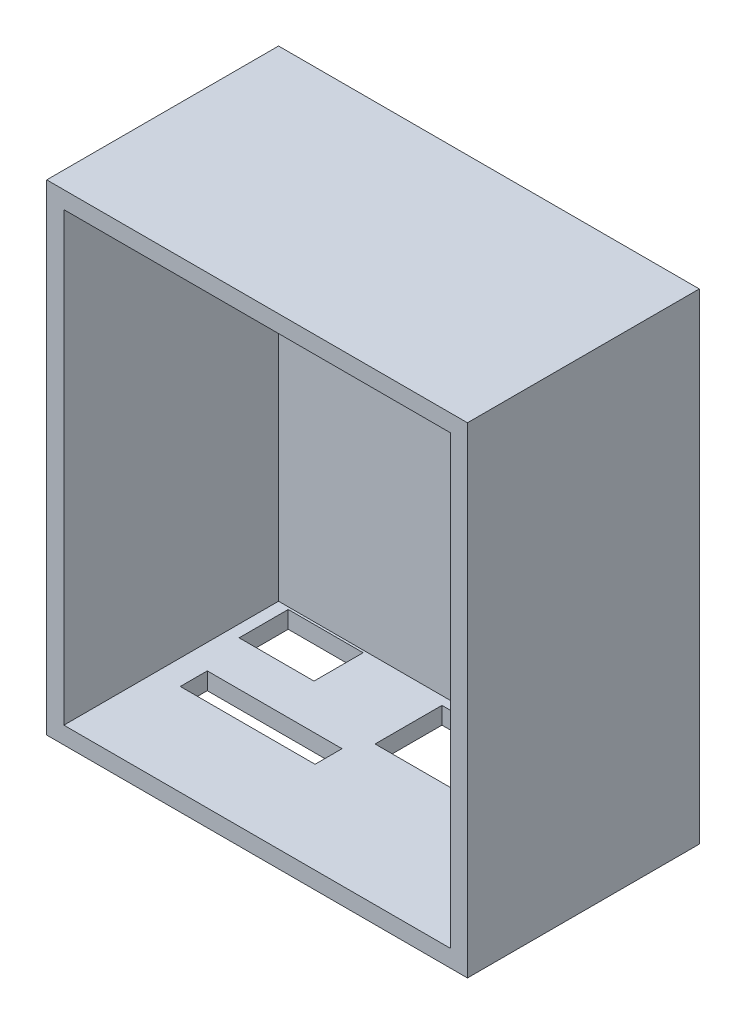
from build123d import *

# Parameters (mm, degrees)
SCHIZZO1_W                   = 49
SCHIZZO1_H                   = 56
ESTRUSIONE_ESTRUSIONE1_DEPTH = 2
SCHIZZO3_W                   = 49
SCHIZZO3_H                   = 2
ESTRUSIONE_ESTRUSIONE2_DEPTH = 25
SCHIZZO4_W                   = 2
SCHIZZO4_H                   = 54
ESTRUSIONE_ESTRUSIONE3_DEPTH = 25
SCHIZZO5_W                   = 47
SCHIZZO5_H                   = 2
ESTRUSIONE_ESTRUSIONE4_DEPTH = 25
SCHIZZO6_W                   = 2
SCHIZZO6_H                   = 52
ESTRUSIONE_ESTRUSIONE5_DEPTH = 25
SCHIZZO7_W                   = 25
SCHIZZO7_H                   = 3
ESTRUSIONE_ESTRUSIONE6_DEPTH = 13.3
SCHIZZO9_W                   = 3.5
SCHIZZO9_H                   = 52
ESTRUSIONE_ESTRUSIONE7_DEPTH = 13.3
SCHIZZO10_W                  = 4
SCHIZZO10_H                  = 1.5
TAGLIO_ESTRUSIONE1_DEPTH     = 6
SCHIZZO11_W                  = 1.5
SCHIZZO11_H                  = 1.5
TAGLIO_ESTRUSIONE2_DEPTH     = 6
SCHIZZO12_W                  = 4
SCHIZZO12_H                  = 1
TAGLIO_ESTRUSIONE3_DEPTH     = 0.75
SCHIZZO13_W                  = 4
SCHIZZO13_H                  = 1
TAGLIO_ESTRUSIONE4_DEPTH     = 0.75
SCHIZZO14_W                  = 4
SCHIZZO14_H                  = 1
TAGLIO_ESTRUSIONE5_DEPTH     = 0.75
SCHIZZO15_W                  = 4
SCHIZZO15_H                  = 1
TAGLIO_ESTRUSIONE6_DEPTH     = 0.75
SCHIZZO21_W                  = 1
SCHIZZO21_H                  = 1.5
TAGLIO_ESTRUSIONE7_DEPTH     = 1
SCHIZZO23_W                  = 2.5
SCHIZZO23_H                  = 0.75
TAGLIO_ESTRUSIONE8_DEPTH     = 1
SCHIZZO24_W                  = 2.496840505
SCHIZZO24_H                  = 0.75
TAGLIO_ESTRUSIONE9_DEPTH     = 1
SCHIZZO26_W                  = 1.003159495
SCHIZZO26_H                  = 3
TAGLIO_ESTRUSIONE10_DEPTH    = 1
SCHIZZO27_W                  = 1
SCHIZZO27_H                  = 3
TAGLIO_ESTRUSIONE11_DEPTH    = 1
SCHIZZO28_W                  = 3.5
SCHIZZO28_H                  = 4
TAGLIO_ESTRUSIONE12_DEPTH    = 1
SCHIZZO33_W                  = 3.5
SCHIZZO33_H                  = 4
TAGLIO_ESTRUSIONE16_DEPTH    = 1
SCHIZZO34_W                  = 8.724662476
SCHIZZO34_H                  = 5.720773809
TAGLIO_ESTRUSIONE17_DEPTH    = 2
SCHIZZO36_W                  = 18.231331737
SCHIZZO36_H                  = 7.790205668
TAGLIO_ESTRUSIONE18_DEPTH    = 2
SCHIZZO37_W                  = 15.695031374
SCHIZZO37_H                  = 3.143719554
TAGLIO_ESTRUSIONE19_DEPTH    = 2


with BuildPart() as part:
    # Schizzo1 → Estrusione-Estrusione1 (new body)
    with BuildSketch(Plane.XY):
        with Locations((24.5, 28)):
            Rectangle(SCHIZZO1_W, SCHIZZO1_H)
    extrude(amount=ESTRUSIONE_ESTRUSIONE1_DEPTH)

    # Schizzo3 → Estrusione-Estrusione2 (add)
    with BuildSketch(Plane.XY.offset(2)):
        with Locations((24.5, 55)):
            Rectangle(SCHIZZO3_W, SCHIZZO3_H)
    extrude(amount=ESTRUSIONE_ESTRUSIONE2_DEPTH)

    # Schizzo4 → Estrusione-Estrusione3 (add)
    with BuildSketch(Plane.XY.offset(2)):
        with Locations((48, 27)):
            Rectangle(SCHIZZO4_W, SCHIZZO4_H)
    extrude(amount=ESTRUSIONE_ESTRUSIONE3_DEPTH)

    # Schizzo5 → Estrusione-Estrusione4 (add)
    with BuildSketch(Plane.XY.offset(2)):
        with Locations((23.5, 1)):
            Rectangle(SCHIZZO5_W, SCHIZZO5_H)
    extrude(amount=ESTRUSIONE_ESTRUSIONE4_DEPTH)

    # Schizzo6 → Estrusione-Estrusione5 (add)
    with BuildSketch(Plane.XY.offset(2)):
        with Locations((1, 28)):
            Rectangle(SCHIZZO6_W, SCHIZZO6_H)
    extrude(amount=ESTRUSIONE_ESTRUSIONE5_DEPTH)

    # Schizzo7 → Estrusione-Estrusione6 (add)
    with BuildSketch(Plane.XY.offset(2)):
        with Locations((14.5, 45.2)):
            Rectangle(SCHIZZO7_W, SCHIZZO7_H)
    extrude(amount=ESTRUSIONE_ESTRUSIONE6_DEPTH)

    # Schizzo9 → Estrusione-Estrusione7 (add)
    with BuildSketch(Plane.XY.offset(2)):
        with Locations((45.25, 28)):
            Rectangle(SCHIZZO9_W, SCHIZZO9_H)
    extrude(amount=ESTRUSIONE_ESTRUSIONE7_DEPTH)

    # Schizzo10 → Taglio-Estrusione1 (cut)
    with BuildSketch(Plane.XY.offset(15.3)):
        with Locations((6, 45.2)):
            Rectangle(SCHIZZO10_W, SCHIZZO10_H)
        with Locations((24, 45.2)):
            Rectangle(SCHIZZO10_W, SCHIZZO10_H)
    extrude(amount=-TAGLIO_ESTRUSIONE1_DEPTH, mode=Mode.SUBTRACT)

    # Schizzo11 → Taglio-Estrusione2 (cut)
    with BuildSketch(Plane.XY.offset(15.3)):
        with Locations((45.25, 45.2)):
            Rectangle(SCHIZZO11_W, SCHIZZO11_H)
    extrude(amount=-TAGLIO_ESTRUSIONE2_DEPTH, mode=Mode.SUBTRACT)

    # Schizzo12 → Taglio-Estrusione3 (cut)
    with BuildSketch(Plane(origin=(0, 45.95, 0), x_dir=(-1, 0, 0), z_dir=(0, -1, 0))):
        with Locations((-6, -14.8)):
            Rectangle(SCHIZZO12_W, SCHIZZO12_H)
    extrude(amount=-TAGLIO_ESTRUSIONE3_DEPTH, mode=Mode.SUBTRACT)

    # Schizzo13 → Taglio-Estrusione4 (cut)
    with BuildSketch(Plane(origin=(0, 44.45, 0), x_dir=(1, 0, 0), z_dir=(0, 1, 0))):
        with Locations((6, -14.8)):
            Rectangle(SCHIZZO13_W, SCHIZZO13_H)
    extrude(amount=-TAGLIO_ESTRUSIONE4_DEPTH, mode=Mode.SUBTRACT)

    # Schizzo14 → Taglio-Estrusione5 (cut)
    with BuildSketch(Plane(origin=(0, 45.95, 0), x_dir=(-1, 0, 0), z_dir=(0, -1, 0))):
        with Locations((-24, -14.8)):
            Rectangle(SCHIZZO14_W, SCHIZZO14_H)
    extrude(amount=-TAGLIO_ESTRUSIONE5_DEPTH, mode=Mode.SUBTRACT)

    # Schizzo15 → Taglio-Estrusione6 (cut)
    with BuildSketch(Plane(origin=(0, 44.45, 0), x_dir=(1, 0, 0), z_dir=(0, 1, 0))):
        with Locations((24, -14.8)):
            Rectangle(SCHIZZO15_W, SCHIZZO15_H)
    extrude(amount=-TAGLIO_ESTRUSIONE6_DEPTH, mode=Mode.SUBTRACT)

    # Schizzo21 → Taglio-Estrusione7 (cut)
    with BuildSketch(Plane.XY.offset(15.3)):
        with Locations((44, 45.2)):
            Rectangle(SCHIZZO21_W, SCHIZZO21_H)
    extrude(amount=-TAGLIO_ESTRUSIONE7_DEPTH, mode=Mode.SUBTRACT)

    # Schizzo23 → Taglio-Estrusione8 (cut)
    with BuildSketch(Plane.XY.offset(15.3)):
        with Locations((44.75, 46.325)):
            Rectangle(SCHIZZO23_W, SCHIZZO23_H)
    extrude(amount=-TAGLIO_ESTRUSIONE8_DEPTH, mode=Mode.SUBTRACT)

    # Schizzo24 → Taglio-Estrusione9 (cut)
    with BuildSketch(Plane.XY.offset(15.3)):
        with Locations((44.748420252, 44.075)):
            Rectangle(SCHIZZO24_W, SCHIZZO24_H)
    extrude(amount=-TAGLIO_ESTRUSIONE9_DEPTH, mode=Mode.SUBTRACT)

    # Schizzo26 → Taglio-Estrusione10 (cut)
    with BuildSketch(Plane.XY.offset(15.3)):
        with Locations((46.498420252, 45.2)):
            Rectangle(SCHIZZO26_W, SCHIZZO26_H)
    extrude(amount=-TAGLIO_ESTRUSIONE10_DEPTH, mode=Mode.SUBTRACT)

    # Schizzo27 → Taglio-Estrusione11 (cut)
    with BuildSketch(Plane.XY.offset(15.3)):
        with Locations((26.5, 45.2)):
            Rectangle(SCHIZZO27_W, SCHIZZO27_H)
    extrude(amount=-TAGLIO_ESTRUSIONE11_DEPTH, mode=Mode.SUBTRACT)

    # Schizzo28 → Taglio-Estrusione12 (cut)
    with BuildSketch(Plane.XY.offset(15.3)):
        with Locations((45.25, 15.3)):
            Rectangle(SCHIZZO28_W, SCHIZZO28_H)
    extrude(amount=-TAGLIO_ESTRUSIONE12_DEPTH, mode=Mode.SUBTRACT)

    # Schizzo33 → Taglio-Estrusione16 (cut)
    with BuildSketch(Plane.XY.offset(15.3)):
        with Locations((45.25, 30.5)):
            Rectangle(SCHIZZO33_W, SCHIZZO33_H)
    extrude(amount=-TAGLIO_ESTRUSIONE16_DEPTH, mode=Mode.SUBTRACT)

    # Schizzo34 → Taglio-Estrusione17 (cut)
    with BuildSketch(Plane.XZ):
        with Locations((7.756146884, 5.127413967)):
            Rectangle(SCHIZZO34_W, SCHIZZO34_H)
    extrude(amount=-TAGLIO_ESTRUSIONE17_DEPTH, mode=Mode.SUBTRACT)

    # Schizzo36 → Taglio-Estrusione18 (cut)
    with BuildSketch(Plane.XZ):
        with Locations((31.131385829, 6.880572543)):
            Rectangle(SCHIZZO36_W, SCHIZZO36_H)
    extrude(amount=-TAGLIO_ESTRUSIONE18_DEPTH, mode=Mode.SUBTRACT)

    # Schizzo37 → Taglio-Estrusione19 (cut)
    with BuildSketch(Plane(origin=(0, 0, 0), x_dir=(-1, 0, 0), z_dir=(0, -1, 0))):
        with Locations((-12.721702287, -14.745938355)):
            Rectangle(SCHIZZO37_W, SCHIZZO37_H)
    extrude(amount=-TAGLIO_ESTRUSIONE19_DEPTH, mode=Mode.SUBTRACT)


solid = part.part
